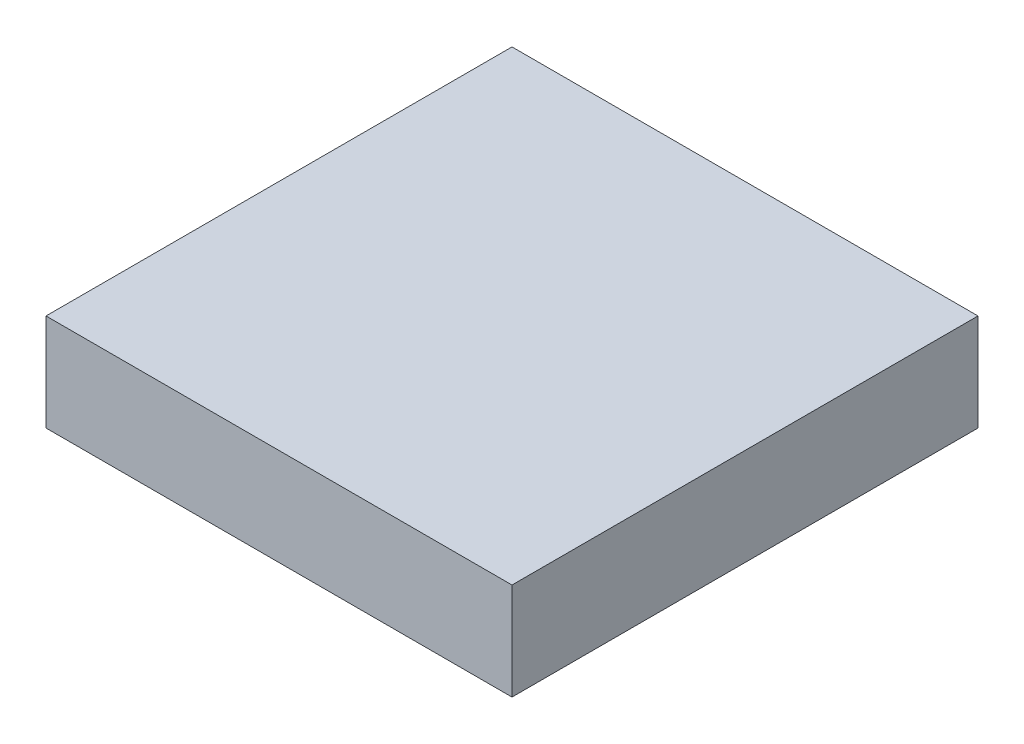
from build123d import *

# Parameters (mm, degrees)
SKETCH1_W           = 120
SKETCH1_H           = 120
BOSS_EXTRUDE1_DEPTH = 25


with BuildPart() as part:
    # Sketch1 → Boss-Extrude1 (new body)
    with BuildSketch(Plane(origin=(0, 0, 0), x_dir=(1, 0, 0), z_dir=(0, 1, 0))):
        Rectangle(SKETCH1_W, SKETCH1_H)
    extrude(amount=BOSS_EXTRUDE1_DEPTH)


solid = part.part
